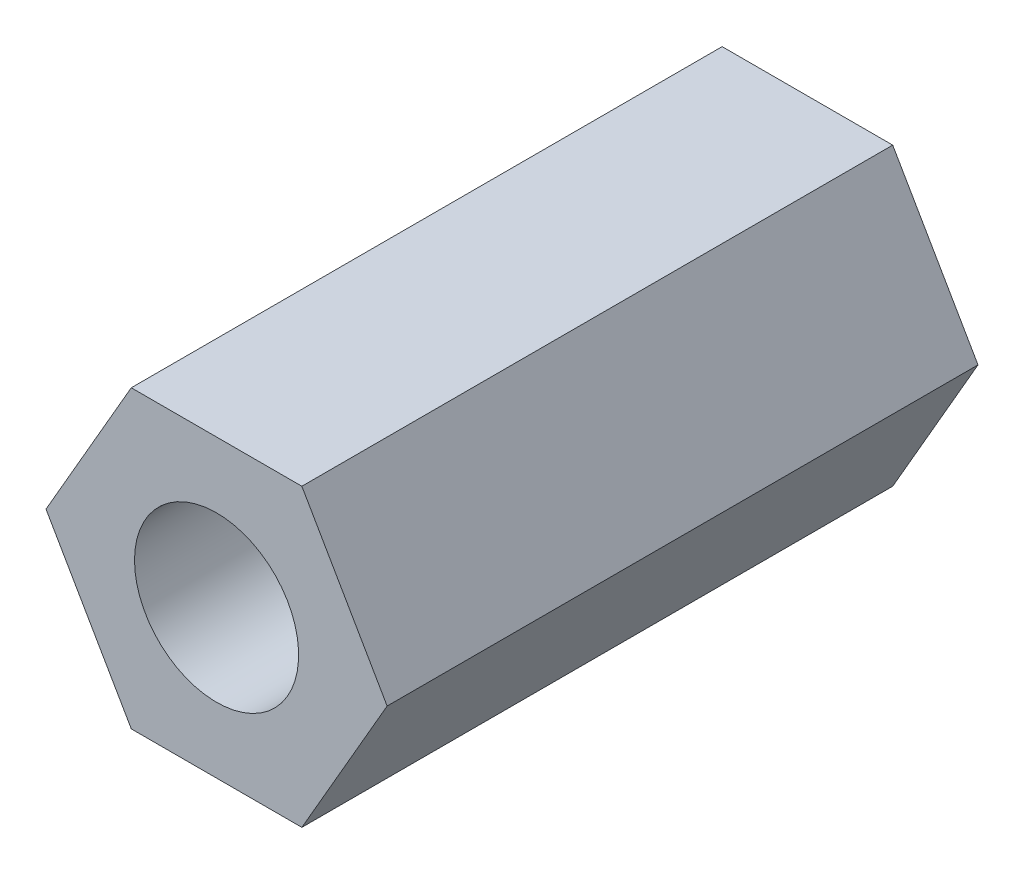
from build123d import *

# Parameters (mm, degrees)
EXTRUDE_1_DEPTH            = 9
HOLE_WIZARD_M3_1_OUTLINE_R = 1.25
HOLE_WIZARD_M3_1_DEPTH     = 9


# Read off the part's stored shape, not the designer's step: M3 螺纹孔1
with BuildPart() as part:
    # 草图1 → 凸台-拉伸1 (new body)
    with BuildSketch(Plane.XY):
        Polygon((2.598076211, 0), (1.299038106, 2.25), (-1.299038106, 2.25), (-2.598076211, 0), (-1.299038106, -2.25), (1.299038106, -2.25), align=None)
    extrude(amount=EXTRUDE_1_DEPTH)

    # M3 螺纹孔1 outline → M3 螺纹孔1 (cut)
    with BuildSketch(Plane.XY):
        Circle(HOLE_WIZARD_M3_1_OUTLINE_R)
    extrude(amount=HOLE_WIZARD_M3_1_DEPTH, mode=Mode.SUBTRACT)


solid = part.part
